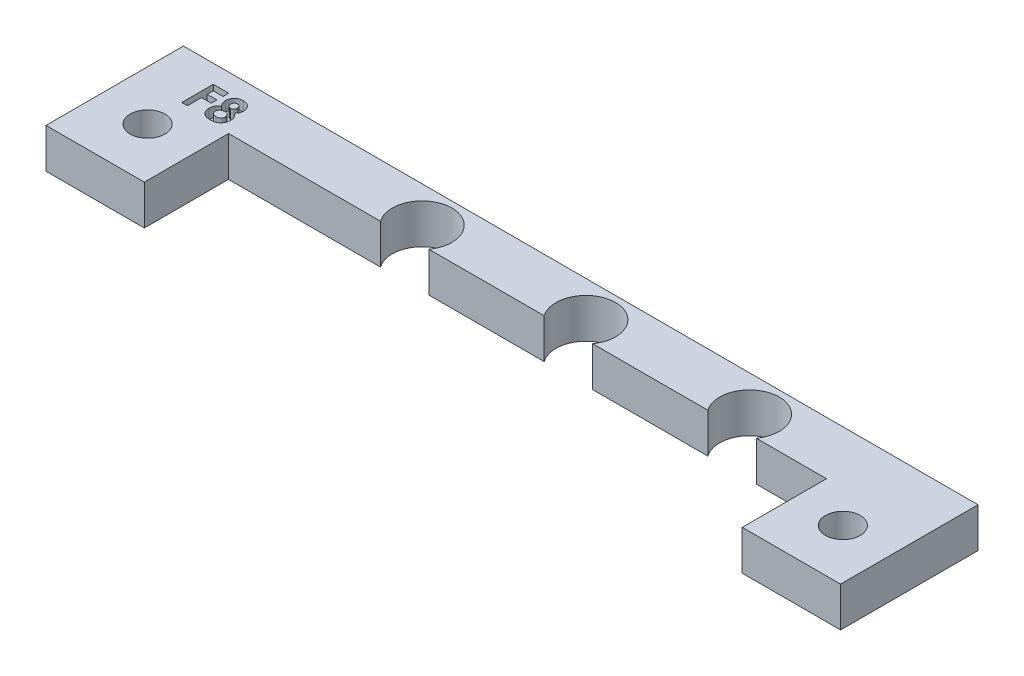
from build123d import *

# Parameters (mm, degrees)
BOSS_EXTRUDE1_OUTLINE_R = 1.75
BOSS_EXTRUDE1_DEPTH     = 4
CUT_EXTRUDE1_DEPTH      = 1


# Read off the part's stored shape, not the designer's step: Boss-Extrude1
with BuildPart() as part:
    # Boss-Extrude1 outline → Boss-Extrude1 (new body)
    with BuildSketch(Plane(origin=(0, 0, 0), x_dir=(1, 0, 0), z_dir=(0, 1, 0))):
        with BuildLine():
            Line((25.306474615, -10.33744254), (36.91307775, -10.33744254))
            ThreePointArc((36.91307775, -10.33744254), (39.349776183, -5.587442326), (41.786474615, -10.33744254))
            Line((41.786474615, -10.33744254), (48.849776182, -10.33744254))
            Line((48.849776182, -10.33744254), (48.849776182, -18.81631662))
            Line((48.849776182, -18.81631662), (58.749776182, -18.81631662))
            Line((58.749776182, -18.81631662), (58.749776182, -4.977921711))
            Line((58.749776182, -4.977921711), (-21.250223818, -4.977921711))
            Line((-21.250223818, -4.977921711), (-21.250223818, -18.81631662))
            Line((-21.250223818, -18.81631662), (-11.350223818, -18.81631662))
            Line((-11.350223818, -18.81631662), (-11.350223818, -10.33744254))
            Line((-11.350223818, -10.33744254), (3.95307775, -10.33744254))
            ThreePointArc((3.95307775, -10.33744254), (6.389776182, -5.587442326), (8.826474615, -10.33744254))
            Line((8.826474615, -10.33744254), (20.43307775, -10.33744254))
            ThreePointArc((20.43307775, -10.33744254), (22.869776182, -5.587442326), (25.306474615, -10.33744254))
        make_face()
        with Locations((-16.250223818, -13.587442433)):
            Circle(BOSS_EXTRUDE1_OUTLINE_R, mode=Mode.SUBTRACT)
        with Locations((53.749776182, -13.587442433)):
            Circle(BOSS_EXTRUDE1_OUTLINE_R, mode=Mode.SUBTRACT)
    extrude(amount=BOSS_EXTRUDE1_DEPTH)

    # Sketch2 → Cut-Extrude1 (cut)
    # profile 1 of 2: a face of its own
    with BuildSketch(Plane(origin=(0, 4, 0), x_dir=(1, 0, 0), z_dir=(0, 1, 0))):
        Polygon((-16.41198232, -6.812466594), (-14.865187448, -6.812466594), (-14.865187448, -7.382338389), (-15.842110525, -7.382338389), (-15.842110525, -7.992915312), (-14.865187448, -7.992915312), (-14.865187448, -8.562787107), (-15.842110525, -8.562787107), (-15.842110525, -9.987466594), (-16.41198232, -9.987466594), align=None)
    # profile 2 of 2: a face of its own
    with BuildSketch(Plane(origin=(0, 4, 0), x_dir=(1, 0, 0), z_dir=(0, 1, 0))):
        with BuildLine():
            add(Edge.make_bspline(
                [(-12.817210686, -8.277851209), (-12.783916812, -8.301640582), (-12.718014592, -8.348729498), (-12.630981866, -8.433091053), (-12.556016347, -8.527197346), (-12.493905254, -8.630471147), (-12.44414372, -8.740373961), (-12.408522012, -8.855731057), (-12.385895512, -8.975524957), (-12.383424023, -9.057083985), (-12.382174628, -9.09831395)],
                knots=[0, 0, 0, 0, 1.013736912, 2.006600758, 2.994453809, 3.989973287, 4.987781207, 5.978959008, 6.978317308, 8, 8, 8, 8], degree=3))
            add(Edge.make_bspline(
                [(-12.382174628, -9.09831395), (-12.383681928, -9.142958744), (-12.386671463, -9.231505963), (-12.413102949, -9.361360446), (-12.455537639, -9.486113154), (-12.513532925, -9.604387133), (-12.586248347, -9.71250688), (-12.671004934, -9.808223668), (-12.767909528, -9.889037688), (-12.858130451, -9.94386948), (-12.93578675, -9.980293202), (-12.998454703, -10.003603653), (-13.064627941, -10.024125244), (-13.134778669, -10.040520633), (-13.208894129, -10.053319925), (-13.28686855, -10.061772553), (-13.368753261, -10.067917099), (-13.424595172, -10.068551539), (-13.453228314, -10.06887685)],
                knots=[0, 0, 0, 0, 1.313679292, 2.605514271, 3.884962679, 5.186178731, 6.472827995, 7.711026938, 8.938935107, 10.174644318, 10.808706728, 11.462743532, 12.142127587, 12.847854939, 13.582806024, 14.355735269, 15.156897313, 16, 16, 16, 16], degree=3))
            add(Edge.make_bspline(
                [(-13.453228314, -10.06887685), (-13.483762719, -10.068462664), (-13.543390392, -10.067653841), (-13.630433512, -10.062763265), (-13.712540889, -10.05374694), (-13.789884756, -10.041877645), (-13.862390702, -10.026171129), (-13.930060872, -10.006256127), (-13.993058665, -9.983580681), (-14.070171273, -9.949055369), (-14.158297, -9.895136701), (-14.253544974, -9.816174366), (-14.337148326, -9.722127758), (-14.409833523, -9.615636751), (-14.467126735, -9.497356478), (-14.509731675, -9.370999371), (-14.534962825, -9.236907843), (-14.538000373, -9.145061739), (-14.539546423, -9.09831395)],
                knots=[0, 0, 0, 0, 0.886964665, 1.7320671, 2.531131818, 3.285397207, 4.004107883, 4.684213108, 5.332925796, 5.947568694, 7.135706876, 8.320776993, 9.52873045, 10.778999824, 12.05415135, 13.333578234, 14.642845846, 16, 16, 16, 16], degree=3))
            add(Edge.make_bspline(
                [(-14.539546423, -9.09831395), (-14.538133592, -9.057534194), (-14.535357209, -8.977397037), (-14.515469601, -8.859970757), (-14.481368397, -8.74863675), (-14.434576238, -8.642619953), (-14.374238543, -8.54190857), (-14.29999851, -8.447243639), (-14.212797428, -8.357771149), (-14.146671217, -8.304933073), (-14.112778594, -8.277851209)],
                knots=[0, 0, 0, 0, 1.01821053, 2.000906977, 2.963938143, 3.919209931, 4.888045165, 5.887808425, 6.917407893, 8, 8, 8, 8], degree=3))
            add(Edge.make_bspline(
                [(-14.112778594, -8.277851209), (-14.133790223, -8.25361737), (-14.175155792, -8.205908238), (-14.228683245, -8.129124193), (-14.27377787, -8.049959762), (-14.312065354, -7.969057406), (-14.340368438, -7.885024188), (-14.361772094, -7.799181284), (-14.373877981, -7.710654149), (-14.375770168, -7.650984229), (-14.37672591, -7.620844999)],
                knots=[0, 0, 0, 0, 1.061529281, 2.089831458, 3.092927091, 4.075998741, 5.048384512, 6.024008542, 7.00192825, 8, 8, 8, 8], degree=3))
            add(Edge.make_bspline(
                [(-14.37672591, -7.620844999), (-14.375458741, -7.580045367), (-14.372958667, -7.499549264), (-14.35081565, -7.381844957), (-14.314052865, -7.270002405), (-14.264040225, -7.164349068), (-14.200531945, -7.067187545), (-14.125070359, -6.98005538), (-14.036594626, -6.906144188), (-13.93839492, -6.842725124), (-13.829979018, -6.792282188), (-13.71237556, -6.756985999), (-13.587004623, -6.734641651), (-13.500602716, -6.732269623), (-13.456408402, -6.731056337)],
                knots=[0, 0, 0, 0, 1.022455555, 2.017265428, 2.990720743, 3.968117071, 4.939886797, 5.893155559, 6.847550415, 7.820889576, 8.817530429, 9.83499769, 10.892607882, 12, 12, 12, 12], degree=3))
            add(Edge.make_bspline(
                [(-13.456408402, -6.731056337), (-13.412850602, -6.732271608), (-13.327922012, -6.734641132), (-13.204754302, -6.756837427), (-13.089692277, -6.792919844), (-12.983687415, -6.844427856), (-12.886503285, -6.907969153), (-12.799531264, -6.984453863), (-12.724306479, -7.073756197), (-12.66027104, -7.173431259), (-12.609244635, -7.280816697), (-12.571520994, -7.393432622), (-12.549701195, -7.510393862), (-12.546570098, -7.589805025), (-12.544995141, -7.629749246)],
                knots=[0, 0, 0, 0, 1.094655142, 2.134348324, 3.136019022, 4.118575226, 5.088726318, 6.048298823, 7.020513804, 8.015920439, 9.020015034, 10.003048569, 10.995523219, 12, 12, 12, 12], degree=3))
            add(Edge.make_bspline(
                [(-12.544995141, -7.629749246), (-12.545753836, -7.657979661), (-12.547242718, -7.713379741), (-12.558251211, -7.794999693), (-12.576788162, -7.873314147), (-12.60263287, -7.950215641), (-12.638565836, -8.027794016), (-12.687191493, -8.107535817), (-12.746338221, -8.19275433), (-12.792789101, -8.248528105), (-12.817210686, -8.277851209)],
                knots=[0, 0, 0, 0, 0.940746401, 1.846144481, 2.739104268, 3.619506754, 4.545839139, 5.581956076, 6.728711598, 8, 8, 8, 8], degree=3))
        make_face()
        with BuildLine():
            add(Edge.make_bspline(
                [(-13.47040079, -7.300928132), (-13.493863602, -7.302059257), (-13.539503955, -7.304259544), (-13.604627394, -7.324119575), (-13.66317549, -7.356602067), (-13.713811769, -7.401304369), (-13.755336157, -7.455543915), (-13.7858543, -7.517903357), (-13.80395192, -7.58761311), (-13.805867905, -7.6364252), (-13.806854115, -7.661550128)],
                knots=[0, 0, 0, 0, 1.018099191, 1.980427864, 2.929421084, 3.909248076, 4.895556904, 5.880788387, 6.909183412, 8, 8, 8, 8], degree=3))
            add(Edge.make_bspline(
                [(-13.806854115, -7.661550128), (-13.805635844, -7.686889627), (-13.803257052, -7.736367441), (-13.784550526, -7.807416545), (-13.752664735, -7.871807238), (-13.70888576, -7.92819461), (-13.655687215, -7.974250185), (-13.596121153, -8.00942487), (-13.529526976, -8.029505185), (-13.483250413, -8.032228147), (-13.45958849, -8.03362044)],
                knots=[0, 0, 0, 0, 1.07118507, 2.091592095, 3.082435519, 4.092579768, 5.090825648, 6.043203473, 6.999459622, 8, 8, 8, 8], degree=3))
            add(Edge.make_bspline(
                [(-13.45958849, -8.03362044), (-13.435479226, -8.032541652), (-13.388509856, -8.03043997), (-13.321749401, -8.009838627), (-13.261606764, -7.976890976), (-13.21010348, -7.930310288), (-13.16744294, -7.873902495), (-13.136374254, -7.808386518), (-13.118492241, -7.734993318), (-13.116104929, -7.683698208), (-13.114866936, -7.657098004)],
                knots=[0, 0, 0, 0, 1.008803858, 1.965339183, 2.900766489, 3.864508618, 4.855158575, 5.849593072, 6.884859315, 8, 8, 8, 8], degree=3))
            add(Edge.make_bspline(
                [(-13.114866936, -7.657098004), (-13.116136245, -7.631989686), (-13.118591044, -7.583431082), (-13.136192895, -7.513716807), (-13.168519575, -7.452330647), (-13.210992661, -7.398427917), (-13.264242529, -7.354958718), (-13.326061725, -7.322991206), (-13.395995039, -7.304449741), (-13.445061785, -7.302127422), (-13.47040079, -7.300928132)],
                knots=[0, 0, 0, 0, 1.065910571, 2.061433587, 3.023559535, 3.990682701, 4.956464619, 5.918590567, 6.925120432, 8, 8, 8, 8], degree=3))
        make_face(mode=Mode.SUBTRACT)
        with BuildLine():
            add(Edge.make_bspline(
                [(-13.451956279, -8.603492235), (-13.46978624, -8.603788328), (-13.50492887, -8.604371924), (-13.556591424, -8.611101658), (-13.606166954, -8.621130626), (-13.653593954, -8.634965304), (-13.698632825, -8.653825453), (-13.741665347, -8.67656171), (-13.782542906, -8.703403911), (-13.820659173, -8.733864736), (-13.855107371, -8.767298393), (-13.886159288, -8.802168614), (-13.911539847, -8.839376887), (-13.9326758, -8.8776864), (-13.949658659, -8.917400732), (-13.960885612, -8.959173898), (-13.968114198, -9.002449596), (-13.969151425, -9.031927247), (-13.969674628, -9.046796522)],
                knots=[0, 0, 0, 0, 1.129580664, 2.226389355, 3.296443603, 4.333934503, 5.352185725, 6.386189251, 7.41493955, 8.447544828, 9.47401038, 10.455044306, 11.4018853, 12.322125673, 13.225630306, 14.132028716, 15.057747923, 16, 16, 16, 16], degree=3))
            add(Edge.make_bspline(
                [(-13.969674628, -9.046796522), (-13.96942526, -9.062303707), (-13.968930669, -9.09306029), (-13.961460572, -9.137952007), (-13.950704952, -9.181246985), (-13.93559834, -9.222539958), (-13.915396116, -9.261806883), (-13.891274294, -9.299429521), (-13.862391756, -9.335144056), (-13.829531642, -9.368758999), (-13.79274489, -9.399085677), (-13.753096834, -9.425804009), (-13.711111133, -9.449360258), (-13.665527406, -9.466326402), (-13.618033802, -9.481855308), (-13.56735795, -9.491276321), (-13.514053346, -9.498208564), (-13.47763421, -9.498735008), (-13.458952473, -9.499005055)],
                knots=[0, 0, 0, 0, 0.973817353, 1.931446211, 2.852767904, 3.776304432, 4.688323523, 5.623710549, 6.581246645, 7.570897993, 8.57436511, 9.572506873, 10.574556662, 11.591826551, 12.624694332, 13.712108235, 14.826391851, 16, 16, 16, 16], degree=3))
            add(Edge.make_bspline(
                [(-13.458952473, -9.499005055), (-13.440068015, -9.498662752), (-13.403268187, -9.497995712), (-13.349474239, -9.492100337), (-13.298594712, -9.482746092), (-13.250690378, -9.469367342), (-13.205580086, -9.452228631), (-13.163868953, -9.430414443), (-13.124604643, -9.405692898), (-13.089048919, -9.37681074), (-13.056583922, -9.345335216), (-13.02861077, -9.310840719), (-13.004825508, -9.274436466), (-12.985640103, -9.235729111), (-12.970159203, -9.194901366), (-12.959540278, -9.151546137), (-12.952950853, -9.106150636), (-12.952351136, -9.075228349), (-12.952046423, -9.059516874)],
                knots=[0, 0, 0, 0, 1.200705402, 2.339794563, 3.437264955, 4.487414319, 5.499029866, 6.500076882, 7.476298407, 8.444948224, 9.407950986, 10.347155707, 11.263432813, 12.167927724, 13.089546445, 14.03463663, 15.00140776, 16, 16, 16, 16], degree=3))
            add(Edge.make_bspline(
                [(-12.952046423, -9.059516874), (-12.952628246, -9.043599995), (-12.953765508, -9.012488012), (-12.959988437, -8.966543851), (-12.971662018, -8.922988069), (-12.986934472, -8.880810497), (-13.007250343, -8.840883929), (-13.032472057, -8.80329263), (-13.061180558, -8.767105421), (-13.094734453, -8.733933223), (-13.131420419, -8.703602043), (-13.170466782, -8.676580291), (-13.211753276, -8.65369536), (-13.255392832, -8.634988065), (-13.301544899, -8.621123427), (-13.349857336, -8.61110201), (-13.40025089, -8.604370418), (-13.434549713, -8.603787874), (-13.451956279, -8.603492235)],
                knots=[0, 0, 0, 0, 1.011708178, 1.977538892, 2.938094892, 3.871441737, 4.823268678, 5.775953079, 6.743660653, 7.753304209, 8.767430709, 9.76505158, 10.765940967, 11.761741361, 12.775867861, 13.822051386, 14.89469657, 16, 16, 16, 16], degree=3))
        make_face(mode=Mode.SUBTRACT)
    extrude(amount=-CUT_EXTRUDE1_DEPTH, mode=Mode.SUBTRACT)


solid = part.part
